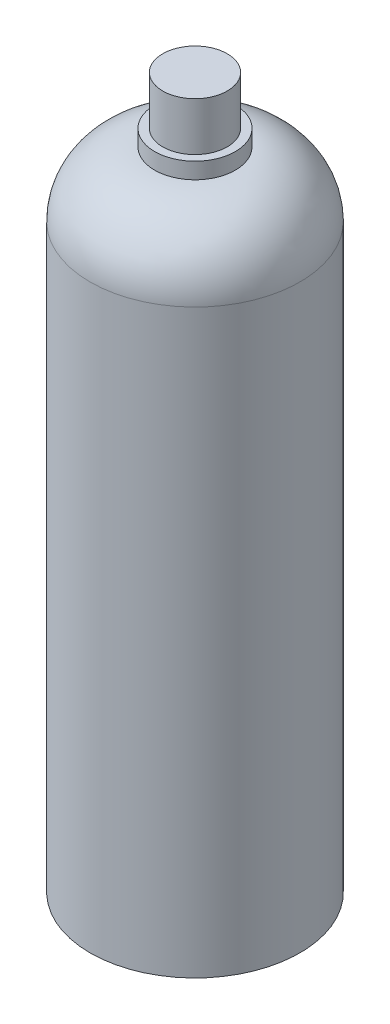
from build123d import *

# Parameters (mm, degrees)
SKETCH_1_R          = 32.5
EXTRUDE_1_DEPTH     = 200
FILLET_1_R          = 20
SKETCH_2_R          = 10
EXTRUDE_2_DEPTH     = 20
CUT_EXTRUDE_START   = -10
SKETCH_3_R          = 2.5
CUT_EXTRUDE_1_DEPTH = 2
SKETCH_2_3_R        = 12.5
SKETCH_2_3_R_2      = 10
EXTRUDE_3_DEPTH     = 5


with BuildPart() as part:
    # 스케치1 → 보스-돌출1 (new body)
    with BuildSketch(Plane(origin=(0, 0, 0), x_dir=(1, 0, 0), z_dir=(0, 1, 0))):
        Circle(SKETCH_1_R)
    extrude(amount=EXTRUDE_1_DEPTH)

    # 필렛1
    fillet_1_edges = [part.edges().sort_by_distance(p)[0] for p in [
        (-32.5, 200, 0),
    ]]
    fillet(fillet_1_edges, radius=FILLET_1_R)

    # 스케치2 → 보스-돌출2 (add)
    with BuildSketch(Plane(origin=(0, 200, 0), x_dir=(1, 0, 0), z_dir=(0, 1, 0))):
        Circle(SKETCH_2_R)
    extrude(amount=EXTRUDE_2_DEPTH)

    # 스케치3 → 컷-돌출1 (cut)
    with BuildSketch(Plane.XY.offset(CUT_EXTRUDE_START)):
        with Locations((0, 215)):
            Circle(SKETCH_3_R)
    extrude(amount=CUT_EXTRUDE_1_DEPTH, mode=Mode.SUBTRACT)

    # 스케치2<3> → 보스-돌출3 (add)
    with BuildSketch(Plane(origin=(0, 200, 0), x_dir=(1, 0, 0), z_dir=(0, 1, 0))):
        Circle(SKETCH_2_3_R)
        Circle(SKETCH_2_3_R_2, mode=Mode.SUBTRACT)
    extrude(amount=EXTRUDE_3_DEPTH)


solid = part.part
